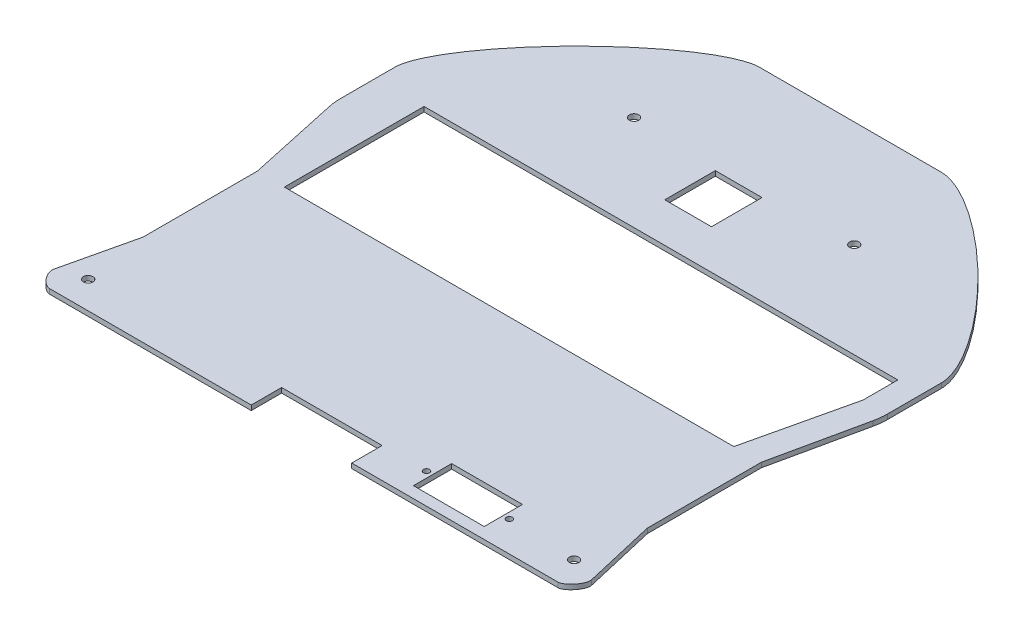
from build123d import *

# Parameters (mm, degrees)
SKETCH1_W           = 80
SKETCH1_H           = 30
SKETCH1_W_2         = 50
BOSS_EXTRUDE1_DEPTH = 1.6
FILLET1_SIZE        = 60
SKETCH6_W           = 80
SKETCH6_H           = 30
CUT_EXTRUDE1_DEPTH  = 10
FILLET3_R           = 20
CUT_EXTRUDE3_REACH  = 256.563
SKETCH9_W           = 15.367
SKETCH9_H           = 16.637
CUT_EXTRUDE5_REACH  = 256.563
SKETCH11_R          = 1.55
SKETCH11_R_2        = 1
SKETCH11_W          = 23.3
SKETCH11_H          = 12.6
CUT_EXTRUDE6_REACH  = 256.563
SKETCH12_W          = 33.087121525
SKETCH12_H          = 10


with BuildPart() as part:
    # Sketch1 → Boss-Extrude1 (new body)
    with BuildSketch(Plane(origin=(0, 0, 0), x_dir=(1, 0, 0), z_dir=(0, 1, 0))):
        with Locations((-90, -15)):
            Rectangle(SKETCH1_W, SKETCH1_H)
        Polygon((0, 180), (-180, 180), (-180, 30), (-130, 30), (-50, 30), (0, 30), align=None)
        with Locations((-25, 15)):
            Rectangle(SKETCH1_W_2, SKETCH1_H)
        with Locations((-155, 15)):
            Rectangle(SKETCH1_W_2, SKETCH1_H)
        with Locations((-90, 15)):
            Rectangle(SKETCH1_W, SKETCH1_H)
    extrude(amount=BOSS_EXTRUDE1_DEPTH)

    # Fillet1
    # a fillet whose section is not a circle: 60 mm, written as the material it takes off along each edge
    with BuildSketch(Plane(origin=(0, -150, -180), x_dir=(0, 0, 1), z_dir=(0, 1, 0)), Plane(origin=(-180, -150, -180), x_dir=(1, 0, 0), z_dir=(0, 1, 0))) as fillet1_piece_1:
        with BuildLine():
            Bezier((FILLET1_SIZE, 0), (0, 0), (0, -FILLET1_SIZE), weights=[1, 0.25, 1])
            Line((0, -FILLET1_SIZE), (0, 0))
            Line((0, 0), (FILLET1_SIZE, 0))
        make_face()
    extrude(amount=301.6, mode=Mode.SUBTRACT)

    # Sketch6 → Cut-Extrude1 (cut)
    with BuildSketch(Plane(origin=(0, 1.6, 0), x_dir=(1, 0, 0), z_dir=(0, 1, 0))):
        with Locations((-90, -15)):
            Rectangle(SKETCH6_W, SKETCH6_H)
        Polygon((-180, 100), (-180, 0), (-173, 30.1112758), (-173, 67.7112758), align=None)
        Polygon((-7, 30.1112758), (0, 0), (0, 100), (-7, 67.7112758), align=None)
    extrude(amount=-CUT_EXTRUDE1_DEPTH, mode=Mode.SUBTRACT)

    # Fillet2
    # a fillet whose section is not a circle: 5 mm, written as the material it takes off along each edge
    with BuildSketch(Plane(origin=(-180, -15.739211431, 0), x_dir=(1, 0, 0), z_dir=(0, 1, 0)), Plane(origin=(0, -15.739211431, 0), x_dir=(-0.22643302171939195, 0, -0.9740267381725335), z_dir=(0, 1, 0))) as fillet2_piece_1:
        with BuildLine():
            Bezier((6.295684572, 0), (0, 0), (1.425550882, 6.132165109), weights=[1, 0.333333333, 1])
            Line((1.425550882, 6.132165109), (0, 0))
            Line((0, 0), (6.295684572, 0))
        make_face()
    extrude(amount=33.078422862, mode=Mode.SUBTRACT)

    # Fillet3
    fillet3_edges = [part.edges().sort_by_distance(p)[0] for p in [
        (0, 0.8, -100),
        (-180, 0.8, -100),
    ]]
    fillet(fillet3_edges, radius=FILLET3_R)

    # Sketch9 → Cut-Extrude3 (cut, up to next)
    with BuildSketch(Plane(origin=(0, 1.6, 0), x_dir=(1, 0, 0), z_dir=(0, 1, 0)), mode=Mode.PRIVATE) as cut_extrude3_sk1:
        Polygon((-164, 113.6), (-164, 67.6), (-16, 67.6), (-8, 102.143047988), (-8, 113.6), align=None)
    cut_extrude3_tool1 = extrude(cut_extrude3_sk1.sketch, amount=-CUT_EXTRUDE3_REACH, mode=Mode.PRIVATE) & part.part
    # Sketch9 → Cut-Extrude3 (cut, up to next)
    with BuildSketch(Plane(origin=(0, 1.6, 0), x_dir=(1, 0, 0), z_dir=(0, 1, 0)), mode=Mode.PRIVATE) as cut_extrude3_sk2:
        with Locations((-90.0575, 134.935)):
            Rectangle(SKETCH9_W, SKETCH9_H)
    cut_extrude3_tool2 = extrude(cut_extrude3_sk2.sketch, amount=-CUT_EXTRUDE3_REACH, mode=Mode.PRIVATE) & part.part
    add(cut_extrude3_tool1.solids().sort_by_distance((-87.479003, 1.6, -90.825495))[0], mode=Mode.SUBTRACT)
    add(cut_extrude3_tool2.solids().sort_by_distance((-90.0575, 1.6, -134.935))[0], mode=Mode.SUBTRACT)

    # Sketch11 → Cut-Extrude5 (cut, up to next)
    with BuildSketch(Plane(origin=(0, 1.6, 0), x_dir=(1, 0, 0), z_dir=(0, 1, 0)), mode=Mode.PRIVATE) as cut_extrude5_sk1:
        with Locations(Location((-170, 9, 0), (0, 0, 270))):
            Circle(SKETCH11_R)
    cut_extrude5_tool1 = extrude(cut_extrude5_sk1.sketch, amount=-CUT_EXTRUDE5_REACH, mode=Mode.PRIVATE) & part.part
    # Sketch11 → Cut-Extrude5 (cut, up to next)
    with BuildSketch(Plane(origin=(0, 1.6, 0), x_dir=(1, 0, 0), z_dir=(0, 1, 0)), mode=Mode.PRIVATE) as cut_extrude5_sk2:
        with Locations(Location((-126.25, 145, 0), (0, 0, 270))):
            Circle(SKETCH11_R)
    cut_extrude5_tool2 = extrude(cut_extrude5_sk2.sketch, amount=-CUT_EXTRUDE5_REACH, mode=Mode.PRIVATE) & part.part
    # Sketch11 → Cut-Extrude5 (cut, up to next)
    with BuildSketch(Plane(origin=(0, 1.6, 0), x_dir=(1, 0, 0), z_dir=(0, 1, 0)), mode=Mode.PRIVATE) as cut_extrude5_sk3:
        with Locations(Location((-10, 9, 0), (0, 0, 270))):
            Circle(SKETCH11_R)
    cut_extrude5_tool3 = extrude(cut_extrude5_sk3.sketch, amount=-CUT_EXTRUDE5_REACH, mode=Mode.PRIVATE) & part.part
    # Sketch11 → Cut-Extrude5 (cut, up to next)
    with BuildSketch(Plane(origin=(0, 1.6, 0), x_dir=(1, 0, 0), z_dir=(0, 1, 0)), mode=Mode.PRIVATE) as cut_extrude5_sk4:
        with Locations(Location((-53.75, 145, 0), (0, 0, 270))):
            Circle(SKETCH11_R)
    cut_extrude5_tool4 = extrude(cut_extrude5_sk4.sketch, amount=-CUT_EXTRUDE5_REACH, mode=Mode.PRIVATE) & part.part
    # Sketch11 → Cut-Extrude5 (cut, up to next)
    with BuildSketch(Plane(origin=(0, 1.6, 0), x_dir=(1, 0, 0), z_dir=(0, 1, 0)), mode=Mode.PRIVATE) as cut_extrude5_sk5:
        with Locations(Location((-32.3, 10, 0), (0, 0, 270))):
            Circle(SKETCH11_R_2)
    cut_extrude5_tool5 = extrude(cut_extrude5_sk5.sketch, amount=-CUT_EXTRUDE5_REACH, mode=Mode.PRIVATE) & part.part
    # Sketch11 → Cut-Extrude5 (cut, up to next)
    with BuildSketch(Plane(origin=(0, 1.6, 0), x_dir=(1, 0, 0), z_dir=(0, 1, 0)), mode=Mode.PRIVATE) as cut_extrude5_sk6:
        with Locations(Location((-59.6, 10, 0), (0, 0, 270))):
            Circle(SKETCH11_R_2)
    cut_extrude5_tool6 = extrude(cut_extrude5_sk6.sketch, amount=-CUT_EXTRUDE5_REACH, mode=Mode.PRIVATE) & part.part
    # Sketch11 → Cut-Extrude5 (cut, up to next)
    with BuildSketch(Plane(origin=(0, 1.6, 0), x_dir=(1, 0, 0), z_dir=(0, 1, 0)), mode=Mode.PRIVATE) as cut_extrude5_sk7:
        with Locations((-45.95, 10)):
            Rectangle(SKETCH11_W, SKETCH11_H)
    cut_extrude5_tool7 = extrude(cut_extrude5_sk7.sketch, amount=-CUT_EXTRUDE5_REACH, mode=Mode.PRIVATE) & part.part
    add(cut_extrude5_tool1.solids().sort_by_distance((-170, 1.6, -9))[0], mode=Mode.SUBTRACT)
    add(cut_extrude5_tool2.solids().sort_by_distance((-126.25, 1.6, -145))[0], mode=Mode.SUBTRACT)
    add(cut_extrude5_tool3.solids().sort_by_distance((-10, 1.6, -9))[0], mode=Mode.SUBTRACT)
    add(cut_extrude5_tool4.solids().sort_by_distance((-53.75, 1.6, -145))[0], mode=Mode.SUBTRACT)
    add(cut_extrude5_tool5.solids().sort_by_distance((-32.3, 1.6, -10))[0], mode=Mode.SUBTRACT)
    add(cut_extrude5_tool6.solids().sort_by_distance((-59.6, 1.6, -10))[0], mode=Mode.SUBTRACT)
    add(cut_extrude5_tool7.solids().sort_by_distance((-45.95, 1.6, -10))[0], mode=Mode.SUBTRACT)

    # Sketch12 → Cut-Extrude6 (cut, up to next)
    with BuildSketch(Plane(origin=(0, 1.6, 0), x_dir=(1, 0, 0), z_dir=(0, 1, 0)), mode=Mode.PRIVATE) as cut_extrude6_sk1:
        with Locations((-90.756439238, 5)):
            Rectangle(SKETCH12_W, SKETCH12_H)
    cut_extrude6_tool1 = extrude(cut_extrude6_sk1.sketch, amount=-CUT_EXTRUDE6_REACH, mode=Mode.PRIVATE) & part.part
    add(cut_extrude6_tool1.solids().sort_by_distance((-90.756439, 1.6, -5))[0], mode=Mode.SUBTRACT)


solid = part.part
